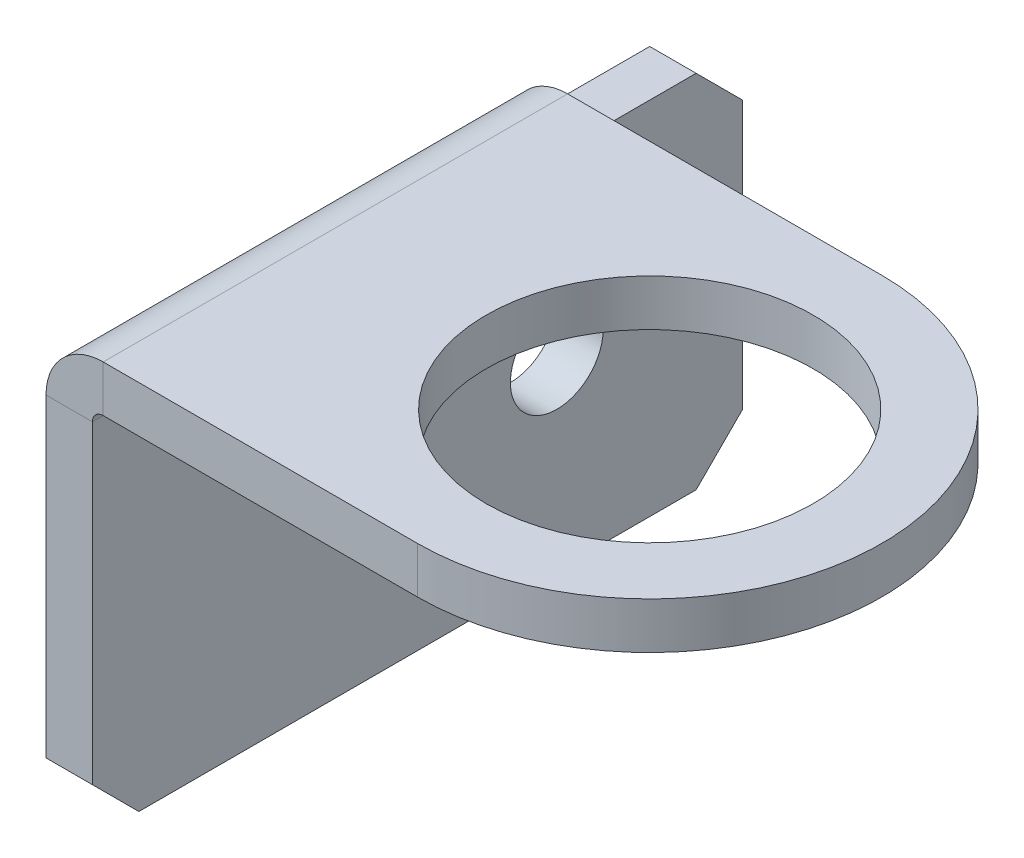
from build123d import *

# Parameters (mm, degrees)
BASE_FLANGE1_DEPTH  = 15.875
CUT_EXTRUDE1_DEPTH  = 51.201157855
SKETCH8_W           = 12.7
SKETCH8_H           = 24.6634
TAB1_DEPTH          = 3.175
SKETCH7_R           = 3.175
CUT_EXTRUDE2_DEPTH  = 54.975
BREAK_CORNER1_START = -3.175
BREAK_CORNER1_DEPTH = 3.175


# Read off the part's stored shape, not the designer's step: Break-Corner1
# Sheet-metal steps are written as plain solids
with BuildPart() as part:
    # Sketch1 → Base-Flange1 (new, symmetric)
    with BuildSketch(Plane.XY):
        with BuildLine():
            Line((0, -25.4), (0, -0.7366))
            ThreePointArc((0, -0.7366), (0.215745145, -0.215745145), (0.7366, 0))
            Line((0.7366, 0), (38.1, 0))
            Line((38.1, 0), (38.1, 3.175))
            Line((38.1, 3.175), (0.7366, 3.175))
            ThreePointArc((0.7366, 3.175), (-2.029318885, 2.029318885), (-3.175, -0.7366))
            Line((-3.175, -0.7366), (-3.175, -25.4))
            Line((-3.175, -25.4), (0, -25.4))
        make_face()
    extrude(amount=BASE_FLANGE1_DEPTH, both=True)

    # Sketch6 → Cut-Extrude1 (cut, through all)
    with BuildSketch(Plane(origin=(0, 3.175, 0), x_dir=(1, 0, 0), z_dir=(0, 1, 0))):
        with BuildLine():
            Line((38.1, -15.875), (38.1, -6.7e-08))
            ThreePointArc((38.1, -6.7e-08), (33.450320128, -11.225320175), (22.225, -15.875))
            Line((22.225, -15.875), (38.1, -15.875))
        make_face()
        with BuildLine():
            Line((38.1, 15.875), (22.225, 15.875))
            ThreePointArc((22.225, 15.875), (33.450320175, 11.225320128), (38.1, -6.7e-08))
            Line((38.1, -6.7e-08), (38.1, 15.875))
        make_face()
        with BuildLine():
            ThreePointArc((33.401, 0), (30.127625387, 7.902625387), (22.225, 11.176))
            Line((22.225, 11.176), (22.225, -11.176))
            ThreePointArc((22.225, -11.176), (30.127625387, -7.902625387), (33.401, 0))
        make_face()
        with BuildLine():
            Line((22.225, -11.176), (22.225, 11.176))
            ThreePointArc((22.225, 11.176), (11.049, 0), (22.225, -11.176))
        make_face()
    extrude(amount=-CUT_EXTRUDE1_DEPTH, mode=Mode.SUBTRACT)

    # Sketch8 → Tab1 (add)
    with BuildSketch(Plane(origin=(0, 0, 0), x_dir=(0, 0, -1), z_dir=(1, 0, 0))):
        with Locations((22.225, -13.0683)):
            Rectangle(SKETCH8_W, SKETCH8_H)
    extrude(amount=-TAB1_DEPTH)

    # Sketch7 → Cut-Extrude2 (cut, through all)
    with BuildSketch(Plane(origin=(0, 0, 0), x_dir=(0, 0, -1), z_dir=(1, 0, 0))):
        with Locations((15.875, -12.7)):
            Circle(SKETCH7_R)
    extrude(amount=-CUT_EXTRUDE2_DEPTH, mode=Mode.SUBTRACT)

    # Break-Corner1 outline → Break-Corner1 (cut)
    with BuildSketch(Plane.YZ.offset(BREAK_CORNER1_START)):
        Polygon((-25.4, -28.575), (-22.225, -28.575), (-25.4, -25.4), align=None)
        Polygon((-25.4, 15.875), (-25.4, 12.7), (-22.225, 15.875), align=None)
        Polygon((-0.7366, -25.4), (-3.9116, -28.575), (-0.7366, -28.575), align=None)
    extrude(amount=BREAK_CORNER1_DEPTH, mode=Mode.SUBTRACT)


solid = part.part
